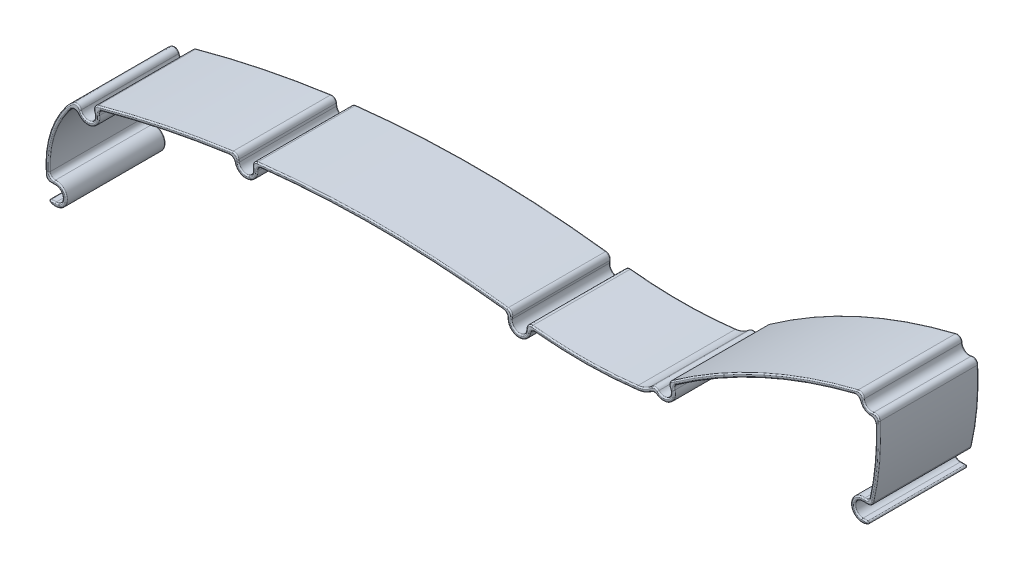
from build123d import *
from build123d.topology import SkipClean

# Parameters (mm, degrees)
EXTRUDE_1_DEPTH     = 40
SKETCH_2_R          = 3
EXTRUDE_1_2_DEPTH   = 40
EXTRUDE_2_DEPTH     = 40
CUT_EXTRUDE_2_DEPTH = 208.592060428
FILLET_1_R          = 2
FILLET_3_R          = 0.5
FILLET_4_R          = 0.5


with BuildPart() as part:
    # ｽｹｯﾁ1 → Extrude 1 (new body)
    with BuildSketch(Plane.XY):
        with BuildLine():
            ThreePointArc((-174.917675812, 6.802025891), (-175.16536545, 24.049389715), (-168.029000204, 39.753058081))
            ThreePointArc((-168.029000204, 39.753058081), (-164.386404751, 43.234236237), (-159.829079223, 45.38316318))
            ThreePointArc((-159.829079223, 45.38316318), (-73.039152779, 60.834071576), (15.071759596, 58.061162838))
            ThreePointArc((15.071759596, 58.061162838), (38.698282136, 56.368912879), (62.348129133, 57.695945012))
            ThreePointArc((62.348129133, 57.695945012), (64.982359088, 58.386614212), (67.332573283, 59.762362967))
            ThreePointArc((67.332573283, 59.762362967), (68.437320119, 60.625078199), (69.547541148, 61.480737248))
            ThreePointArc((69.547541148, 61.480737248), (69.829795591, 61.819116287), (69.939206591, 62.245961901))
            ThreePointArc((69.939206591, 62.245961901), (71.148233251, 64.567309568), (73.719523874, 65.056047728))
            ThreePointArc((73.719523874, 65.056047728), (74.15979094, 65.03780341), (74.565156848, 65.21056459))
            ThreePointArc((74.565156848, 65.21056459), (113.346908434, 87.575280448), (155.853132865, 101.626104486))
            ThreePointArc((155.853132865, 101.626104486), (158.26218824, 101.124572816), (159.485666507, 98.989582711))
            ThreePointArc((159.485666507, 98.989582711), (159.562144442, 78.779630656), (155.859832877, 58.911543179))
            Line((155.859832877, 58.911543179), (154.417522154, 59.323538057))
            ThreePointArc((154.417522154, 59.323538057), (158.068245541, 78.914782698), (157.992833254, 98.843128361))
            ThreePointArc((157.992833254, 98.843128361), (157.38109412, 99.910623413), (156.176566433, 100.161389249))
            ThreePointArc((156.176566433, 100.161389249), (113.960157168, 86.206366284), (75.442826616, 63.994137124))
            ThreePointArc((75.442826616, 63.994137124), (74.429411845, 63.562234175), (73.32874418, 63.607844969))
            ThreePointArc((73.32874418, 63.607844969), (72.043098868, 63.363475889), (71.438585538, 62.202802056))
            ThreePointArc((71.438585538, 62.202802056), (71.165058039, 61.135688021), (70.459421932, 60.289740423))
            ThreePointArc((70.459421932, 60.289740423), (69.356770591, 59.439915413), (68.259556121, 58.583082331))
            ThreePointArc((68.259556121, 58.583082331), (65.556810089, 57.000971383), (62.527445976, 56.206701758))
            ThreePointArc((62.527445976, 56.206701758), (38.68669584, 54.868957627), (14.869458419, 56.574867365))
            ThreePointArc((14.869458419, 56.574867365), (-72.930878607, 59.337984435), (-159.414875998, 43.941485058))
            ThreePointArc((-159.414875998, 43.941485058), (-163.537227688, 41.997749947), (-166.832146939, 38.848877645))
            ThreePointArc((-166.832146939, 38.848877645), (-173.697107608, 23.742438725), (-173.458837906, 7.151012945))
            Line((-173.458837906, 7.151012945), (-174.917675812, 6.802025891))
        make_face()
    extrude(amount=EXTRUDE_1_DEPTH)

    # ｽｹｯﾁ2 → Extrude 1 2 (add, through all)
    with BuildSketch(Plane.XY):
        with Locations((156.5, 98.696674011)):
            Circle(SKETCH_2_R)
        with Locations((152.975211431, 59.735532934)):
            Circle(SKETCH_2_R)
        with Locations((72.937964485, 62.15964221)):
            Circle(SKETCH_2_R)
        with Locations((14.667154113, 55.08857315)):
            Circle(SKETCH_2_R)
        with Locations((-95.332845887, 55.602740192)):
            Circle(SKETCH_2_R)
        with Locations((-159, 42.5)):
            Circle(SKETCH_2_R)
        with Locations((-172, 7.5)):
            Circle(SKETCH_2_R)
    extrude(amount=EXTRUDE_1_2_DEPTH)

    # ｽｹｯﾁ3 → ﾎﾞｽ - 押し出し2 (add, through all)
    with SkipClean():  # the faces are left unmerged after this step: merging them gives an invalid solid
        with BuildSketch(Plane.XY.offset(40)):
            with BuildLine():
                ThreePointArc((155.105149564, 61.848200335), (155.309814131, 62.650779102), (155.508210181, 63.454930376))
                ThreePointArc((155.508210181, 63.454930376), (148.997241196, 57.631785608), (157.475211431, 59.735532934))
                ThreePointArc((157.475211431, 59.735532934), (157.288117426, 61.019605313), (156.742392819, 62.196903362))
                ThreePointArc((156.742392819, 62.196903362), (156.314091206, 60.550736841), (155.859832877, 58.911543179))
                ThreePointArc((155.859832877, 58.911543179), (150.069623581, 58.988834035), (155.105149564, 61.848200335))
            make_face()
            with BuildLine():
                ThreePointArc((156.742392819, 62.196903362), (156.187488729, 62.886925414), (155.508210181, 63.454930376))
                ThreePointArc((155.508210181, 63.454930376), (155.309814131, 62.650779102), (155.105149564, 61.848200335))
                ThreePointArc((155.105149564, 61.848200335), (150.069623581, 58.988834035), (155.859832877, 58.911543179))
                ThreePointArc((155.859832877, 58.911543179), (156.314091206, 60.550736841), (156.742392819, 62.196903362))
            make_face()
            with BuildLine():
                ThreePointArc((153.634250899, 99.584075889), (152.831051821, 99.395038452), (152.028572351, 99.202969162))
                ThreePointArc((152.028572351, 99.202969162), (153.837741702, 95.068674458), (158.324352301, 94.583069912))
                ThreePointArc((158.324352301, 94.583069912), (158.27349835, 95.409770667), (158.216195446, 96.236049458))
                ThreePointArc((158.216195446, 96.236049458), (154.730059706, 96.274420648), (153.634250899, 99.584075889))
            make_face()
            with BuildLine():
                ThreePointArc((70.459421932, 60.289740423), (69.906180844, 59.864751513), (69.354299522, 59.437998327))
                ThreePointArc((69.354299522, 59.437998327), (74.373845341, 57.894874202), (77.437964485, 62.15964221))
                ThreePointArc((77.437964485, 62.15964221), (77.217292333, 63.55153056), (76.576918629, 64.806907354))
                ThreePointArc((76.576918629, 64.806907354), (76.009223863, 64.40142748), (75.442826616, 63.994137124))
                ThreePointArc((75.442826616, 63.994137124), (75.399998918, 63.963913966), (75.356546973, 63.934595379))
                ThreePointArc((75.356546973, 63.934595379), (74.72769572, 59.751974852), (70.541302553, 60.35520003))
                ThreePointArc((70.541302553, 60.35520003), (70.500705388, 60.322041001), (70.459421932, 60.289740423))
            make_face()
            with BuildLine():
                ThreePointArc((12.289483713, 56.91796744), (11.472492469, 57.023256633), (10.655298124, 57.126957688))
                ThreePointArc((10.655298124, 57.126957688), (13.619144559, 50.712310364), (19.167154113, 55.08857315))
                ThreePointArc((19.167154113, 55.08857315), (19.140980955, 55.573210523), (19.062765943, 56.052210345))
                ThreePointArc((19.062765943, 56.052210345), (18.249123765, 56.1461181), (17.435899956, 56.243582438))
                ThreePointArc((17.435899956, 56.243582438), (14.277367269, 52.114003228), (12.289483713, 56.91796744))
            make_face()
            with BuildLine():
                ThreePointArc((-98.102305571, 56.756036796), (-98.918773563, 56.646764089), (-99.735027626, 56.535904666))
                ThreePointArc((-99.735027626, 56.535904666), (-95.801984552, 51.127261568), (-90.832845887, 55.602740192))
                ThreePointArc((-90.832845887, 55.602740192), (-90.951732307, 56.630282793), (-91.302109797, 57.603531678))
                ThreePointArc((-91.302109797, 57.603531678), (-92.120237861, 57.507474522), (-92.938177679, 57.409827398))
                ThreePointArc((-92.938177679, 57.409827398), (-94.956046603, 52.626497208), (-98.102305571, 56.756036796))
            make_face()
            with BuildLine():
                ThreePointArc((-161.968675598, 42.932394718), (-162.736296322, 42.509116787), (-163.47635635, 42.039311575))
                ThreePointArc((-163.47635635, 42.039311575), (-158.769352625, 38.0059148), (-154.5, 42.5))
                ThreePointArc((-154.5, 42.5), (-154.710957632, 43.861659124), (-155.324051364, 45.095650521))
                ThreePointArc((-155.324051364, 45.095650521), (-156.117747866, 44.875181143), (-156.911014356, 44.653169519))
                ThreePointArc((-156.911014356, 44.653169519), (-158.033702901, 39.659882059), (-161.968675598, 42.932394718))
            make_face()
            with BuildLine():
                ThreePointArc((-175.578603832, 10.228295184), (-173.439840747, 3.236567272), (-167.5, 7.5))
                ThreePointArc((-167.5, 7.5), (-169.737135307, 11.389658518), (-174.224197059, 11.411898189))
                ThreePointArc((-174.224197059, 11.411898189), (-174.113884067, 10.579249836), (-173.985166515, 9.74924741))
                ThreePointArc((-173.985166515, 9.74924741), (-169.139756236, 6.595010712), (-174.917675812, 6.802025891))
                ThreePointArc((-174.917675812, 6.802025891), (-175.286049309, 8.50784779), (-175.578603832, 10.228295184))
            make_face()
            with BuildLine():
                ThreePointArc((-173.985166515, 9.74924741), (-174.113884067, 10.579249836), (-174.224197059, 11.411898189))
                ThreePointArc((-174.224197059, 11.411898189), (-174.961140585, 10.888457825), (-175.578603832, 10.228295184))
                ThreePointArc((-175.578603832, 10.228295184), (-175.286049309, 8.50784779), (-174.917675812, 6.802025891))
                ThreePointArc((-174.917675812, 6.802025891), (-169.139756236, 6.595010712), (-173.985166515, 9.74924741))
            make_face()
            with BuildLine():
                ThreePointArc((-174.917675812, 6.802025891), (-169.139756236, 6.595010712), (-173.985166515, 9.74924741))
                ThreePointArc((-173.985166515, 9.74924741), (-173.403193785, 25.035153743), (-166.832146939, 38.848877645))
                ThreePointArc((-166.832146939, 38.848877645), (-164.631459446, 41.165814703), (-161.968675598, 42.932394718))
                ThreePointArc((-161.968675598, 42.932394718), (-158.033702901, 39.659882059), (-156.911014356, 44.653169519))
                ThreePointArc((-156.911014356, 44.653169519), (-127.721253028, 51.747326401), (-98.102305571, 56.756036796))
                ThreePointArc((-98.102305571, 56.756036796), (-94.956046603, 52.626497208), (-92.938177679, 57.409827398))
                ThreePointArc((-92.938177679, 57.409827398), (-40.309022297, 60.442434008), (12.289483713, 56.91796744))
                ThreePointArc((12.289483713, 56.91796744), (14.277367269, 52.114003228), (17.435899956, 56.243582438))
                ThreePointArc((17.435899956, 56.243582438), (39.98055891, 54.863431307), (62.527445397, 56.206701272))
                ThreePointArc((62.527445397, 56.206701272), (65.556809954, 57.000970881), (68.259556248, 58.583082168))
                ThreePointArc((68.259556248, 58.583082168), (69.356770591, 59.439915413), (70.459421932, 60.289740423))
                ThreePointArc((70.459421932, 60.289740423), (70.500705388, 60.322041001), (70.541302553, 60.35520003))
                ThreePointArc((70.541302553, 60.35520003), (74.72769572, 59.751974852), (75.356546973, 63.934595379))
                ThreePointArc((75.356546973, 63.934595379), (75.399998918, 63.963913966), (75.442826616, 63.994137124))
                ThreePointArc((75.442826616, 63.994137124), (112.772142039, 85.669896417), (153.634250899, 99.584075889))
                ThreePointArc((153.634250899, 99.584075889), (154.730059706, 96.274420648), (158.216195446, 96.236049458))
                ThreePointArc((158.216195446, 96.236049458), (158.068245541, 78.914782698), (155.105149564, 61.848200335))
                ThreePointArc((155.105149564, 61.848200335), (150.069623581, 58.988834035), (155.859832877, 58.911543179))
                ThreePointArc((155.859832877, 58.911543179), (159.562144442, 78.779630656), (159.485666507, 98.989582711))
                ThreePointArc((159.485666507, 98.989582711), (158.26218824, 101.124572816), (155.853132865, 101.626104486))
                ThreePointArc((155.853132865, 101.626104486), (113.346908434, 87.575280448), (74.565156848, 65.21056459))
                ThreePointArc((74.565156848, 65.21056459), (74.15979094, 65.03780341), (73.719523874, 65.056047728))
                ThreePointArc((73.719523874, 65.056047728), (71.148233251, 64.567309568), (69.939206591, 62.245961901))
                ThreePointArc((69.939206591, 62.245961901), (69.829795591, 61.819116287), (69.547541148, 61.480737248))
                ThreePointArc((69.547541148, 61.480737248), (68.437320119, 60.625078199), (67.332573283, 59.762362967))
                ThreePointArc((67.332573283, 59.762362967), (64.982359088, 58.386614212), (62.348129133, 57.695945012))
                ThreePointArc((62.348129133, 57.695945012), (38.698282167, 56.368913497), (15.07175968, 58.061163451))
                ThreePointArc((15.07175968, 58.061163451), (-73.039152866, 60.83407219), (-159.829079451, 45.383163973))
                ThreePointArc((-159.829079451, 45.383163973), (-164.386405219, 43.234236917), (-168.029000204, 39.753058081))
                ThreePointArc((-168.029000204, 39.753058081), (-175.16536545, 24.049389715), (-174.917675812, 6.802025891))
            make_face()
        extrude(amount=-EXTRUDE_2_DEPTH)
    add(part.part.scale(1), mode=Mode.REPLACE)  # the faces are merged on a copy

    # ｽｹｯﾁ4 → ｶｯﾄ - 押し出し2 (cut, through all)
    with BuildSketch(Plane.XY.offset(40)):
        with BuildLine():
            Line((-161.881126724, 41.663872737), (-162.717256801, 44.545009155))
            ThreePointArc((-162.717256801, 44.545009155), (-160.67225734, 48.262263142), (-156.955003353, 46.217263682))
            Line((-156.955003353, 46.217263682), (-156.118873276, 43.336127263))
            ThreePointArc((-156.118873276, 43.336127263), (-158.163872737, 39.618873276), (-161.881126724, 41.663872737))
        make_face()
        with BuildLine():
            Line((-172, 4.5), (-176.5, 4.5))
            ThreePointArc((-176.5, 4.5), (-179.5, 7.5), (-176.5, 10.5))
            Line((-176.5, 10.5), (-172, 10.5))
            ThreePointArc((-172, 10.5), (-169, 7.5), (-172, 4.5))
        make_face()
        with BuildLine():
            Line((-98.309088871, 55.225940908), (-98.685888052, 58.202183073))
            ThreePointArc((-98.685888052, 58.202183073), (-96.086444352, 61.555225341), (-92.733402084, 58.955781642))
            Line((-92.733402084, 58.955781642), (-92.356602903, 55.979539476))
            ThreePointArc((-92.356602903, 55.979539476), (-94.956046603, 52.626497208), (-98.309088871, 55.225940908))
        make_face()
        with BuildLine():
            Line((11.694563608, 55.493178744), (12.099169116, 58.465768619))
            ThreePointArc((12.099169116, 58.465768619), (15.476365216, 61.03375353), (18.044350127, 57.65655743))
            Line((18.044350127, 57.65655743), (17.639744618, 54.683967555))
            ThreePointArc((17.639744618, 54.683967555), (14.262548518, 52.115982644), (11.694563608, 55.493178744))
        make_face()
        with BuildLine():
            Line((70.530297127, 60.369910976), (68.740565893, 62.777578334))
            ThreePointArc((68.740565893, 62.777578334), (69.358502016, 66.974976927), (73.555900609, 66.357040803))
            Line((73.555900609, 66.357040803), (75.345631843, 63.949373445))
            ThreePointArc((75.345631843, 63.949373445), (74.72769572, 59.751974852), (70.530297127, 60.369910976))
        make_face()
        with BuildLine():
            Line((154.072101195, 100.458862251), (155.834289436, 102.886761056))
            ThreePointArc((155.834289436, 102.886761056), (160.024376481, 103.55247162), (160.690087045, 99.362384575))
            Line((160.690087045, 99.362384575), (158.927898805, 96.934485771))
            ThreePointArc((158.927898805, 96.934485771), (154.73781176, 96.268775206), (154.072101195, 100.458862251))
        make_face()
        with BuildLine():
            Line((152.975211431, 62.735532934), (157.475211431, 62.735532934))
            ThreePointArc((157.475211431, 62.735532934), (160.475211431, 59.735532934), (157.475211431, 56.735532934))
            Line((157.475211431, 56.735532934), (152.975211431, 56.735532934))
            ThreePointArc((152.975211431, 56.735532934), (149.975211431, 59.735532934), (152.975211431, 62.735532934))
        make_face()
    extrude(amount=-CUT_EXTRUDE_2_DEPTH, mode=Mode.SUBTRACT)

    # ﾌｨﾚｯﾄ1
    fillet_1_edges = [part.edges().sort_by_distance(p)[0] for p in [
        (-174.224197059, 11.411898189, 20),
        (-155.324051364, 45.095650521, 20),
        (-99.735027626, 56.535904666, 20),
        (-91.302109797, 57.603531678, 20),
        (10.655298124, 57.126957688, 20),
        (19.062765943, 56.052210345, 20),
        (69.354299522, 59.437998327, 20),
        (76.576918629, 64.806907354, 20),
        (152.028572351, 99.202969162, 20),
        (158.324352301, 94.583069912, 20),
        (155.508210181, 63.454930376, 20),
        (156.876524055, 62.735532934, 20),
        (159.591463431, 97.848728486, 20),
        (154.738438299, 101.376924818, 20),
        (74.458181594, 65.14323147, 20),
        (69.642846878, 61.563769001, 20),
        (18.047519346, 57.680566039, 20),
        (12.0977422, 58.455285231, 20),
        (-92.732073243, 58.945285465, 20),
        (-98.684559207, 58.191686864, 20),
        (-156.950021623, 46.200097642, 20),
        (-162.638748681, 44.274485931, 20),
        (-175.617677363, 10.5, 20),
        (-163.47635635, 42.039311575, 20),
    ]]
    fillet(fillet_1_edges, radius=FILLET_1_R)

    # ﾌｨﾚｯﾄ3
    fillet_3_edges = [part.edges().sort_by_distance(p)[0] for p in [
        (-175.354101966, 4.5, 20),
        (156.329313397, 56.735532934, 20),
    ]]
    fillet(fillet_3_edges, radius=FILLET_3_R)

    # ﾌｨﾚｯﾄ4
    fillet_4_edges = [part.edges().sort_by_distance(p)[0] for p in [
        (-172.852772551, 27.036503028, 40),
        (-172.852772551, 27.036503028, 0),
        (-174.496755599, 26.76353818, 40),
        (64.982359088, 58.386614212, 40),
        (41.171934255, 56.366268849, 40),
        (37.32663542, 54.884402397, 40),
        (-156.25241115, 43.796271973, 40),
        (-158.163872737, 39.618873276, 40),
        (-156.25241115, 43.796271973, 0),
        (-158.163872737, 39.618873276, 0),
        (-172.919038538, 10.5, 0),
        (-172.919038538, 10.5, 40),
        (-169, 7.5, 40),
        (-169, 7.5, 0),
        (-92.4175483, 56.460931868, 40),
        (-94.956046603, 52.626497208, 40),
        (-92.4175483, 56.460931868, 0),
        (-94.956046603, 52.626497208, 0),
        (14.262548518, 52.115982644, 40),
        (17.711667491, 55.212376579, 40),
        (14.262548518, 52.115982644, 0),
        (17.711667491, 55.212376579, 0),
        (149.975211431, 59.735532934, 40),
        (153.943457268, 56.735532934, 40),
        (149.975211431, 59.735532934, 0),
        (153.943457268, 56.735532934, 0),
        (-157.222222844, 38.366054139, 40),
        (-157.222222844, 38.366054139, 0),
        (-127.7212524, 51.747326519, 0),
        (-127.7212524, 51.747326519, 40),
        (-94.85985575, 51.127666971, 40),
        (-94.85985575, 51.127666971, 0),
        (-40.309022297, 60.442434008, 0),
        (-40.309022297, 60.442434008, 40),
        (14.115637874, 50.62249771, 40),
        (14.115637874, 50.62249771, 0),
        (65.429568152, 56.949108434, 40),
        (65.429568152, 56.949108434, 0),
        (75.621371199, 58.547256792, 40),
        (75.621371199, 58.547256792, 0),
        (112.400183249, 85.500173809, 0),
        (112.400183249, 85.500173809, 40),
        (153.827551561, 95.076174137, 40),
        (153.827551561, 95.076174137, 0),
        (158.068245541, 78.914782698, 0),
        (158.068245541, 78.914782698, 40),
        (148.538237858, 58.985022768, 40),
        (148.538237858, 58.985022768, 0),
        (159.585920071, 79.046123951, 0),
        (159.585920071, 79.046123951, 40),
        (-166.634814433, 41.359610926, 0),
        (-161.890971039, 41.697794272, 0),
        (-128.024778685, 53.216297373, 0),
        (-98.370034264, 55.707333273, 0),
        (-40.302010998, 61.942418726, 0),
        (11.760006542, 55.973980411, 0),
        (67.692381882, 60.044588841, 0),
        (74.72769572, 59.751974852, 0),
        (111.949802025, 86.943547277, 0),
        (154.723182233, 96.279461024, 0),
        (154.13630839, 62.735532934, 0),
        (-166.307123073, 39.502792681, 0),
        (-175.18499823, 11.021553718, 0),
        (-163.196649172, 43.074160345, 0),
        (-156.21061286, 45.790321687, 0),
        (-99.199108533, 57.525374806, 0),
        (-92.067706458, 58.428226942, 0),
        (11.428570831, 57.944459992, 0),
        (18.533672833, 57.046818746, 0),
        (69.440025994, 60.742330955, 0),
        (75.303219572, 65.100715699, 0),
        (152.715168975, 100.150386551, 0),
        (159.026732407, 95.51117627, 0),
        (156.542606194, 63.17045311, 0),
        (154.13630839, 62.735532934, 40),
        (-166.307123073, 39.502792681, 40),
        (154.723182233, 96.279461024, 40),
        (111.949802025, 86.943547277, 40),
        (74.72769572, 59.751974852, 40),
        (67.692381882, 60.044588841, 40),
        (11.760006542, 55.973980411, 40),
        (-40.302010998, 61.942418726, 40),
        (-98.370034264, 55.707333273, 40),
        (-128.024778685, 53.216297373, 40),
        (-161.890971039, 41.697794272, 40),
        (-166.634814433, 41.359610926, 40),
        (-175.18499823, 11.021553718, 40),
        (-163.196649172, 43.074160345, 40),
        (-156.21061286, 45.790321687, 40),
        (-99.199108533, 57.525374806, 40),
        (-92.067706458, 58.428226942, 40),
        (11.428570831, 57.944459992, 40),
        (18.533672833, 57.046818746, 40),
        (69.440025994, 60.742330955, 40),
        (75.303219572, 65.100715699, 40),
        (152.715168975, 100.150386551, 40),
        (159.026732407, 95.51117627, 40),
        (156.542606194, 63.17045311, 40),
        (-173.768568414, 12.485677184, 40),
        (-173.768568414, 12.485677184, 0),
        (-154.322969262, 44.816153309, 40),
        (-154.322969262, 44.816153309, 0),
        (-100.544388476, 55.883817911, 40),
        (-100.544388476, 55.883817911, 0),
        (-90.355778022, 57.17371948, 40),
        (-90.355778022, 57.17371948, 0),
        (9.704989693, 56.706010853, 40),
        (9.704989693, 56.706010853, 0),
        (19.853694224, 55.435635153, 40),
        (19.853694224, 55.435635153, 0),
        (69.202538318, 58.814048447, 40),
        (69.202538318, 58.814048447, 0),
        (77.227575415, 64.793075978, 40),
        (77.227575415, 64.793075978, 0),
        (151.279758761, 98.466578224, 40),
        (151.279758761, 98.466578224, 0),
        (64.982359088, 58.386614212, 0),
        (157.829689409, 93.629137307, 40),
        (157.829689409, 93.629137307, 0),
        (155.19278095, 64.482151477, 40),
        (155.19278095, 64.482151477, 0),
        (-164.153767397, 40.733981209, 40),
        (-164.153767397, 40.733981209, 0),
        (-174.496755599, 26.76353818, 0),
        (41.171934255, 56.366268849, 0),
        (-169.714555743, 3.623565485, 0),
        (-172.968245837, 4.5, 0),
        (-174.420614591, 4.125, 0),
        (155.395826022, 56.360532934, 0),
        (-172.968245837, 4.5, 40),
        (-169.714555743, 3.623565485, 40),
        (-174.420614591, 4.125, 40),
        (155.395826022, 56.360532934, 40),
        (37.32663542, 54.884402397, 0),
    ]]
    fillet(fillet_4_edges, radius=FILLET_4_R)


solid = part.part
